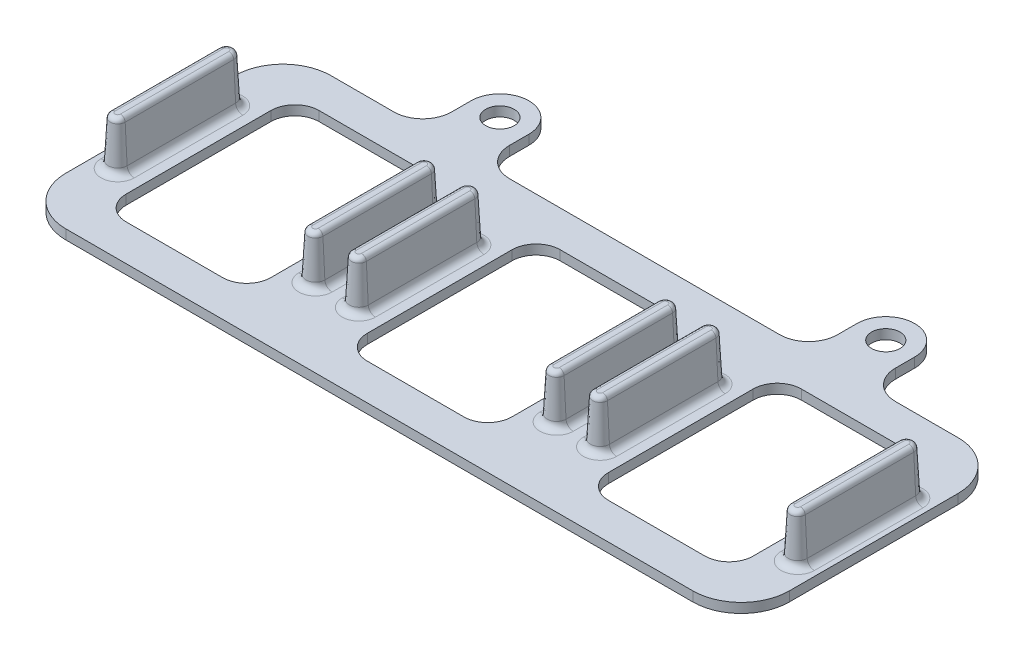
from build123d import *

# Parameters (mm, degrees)
SKETCH1_W                 = 150
SKETCH1_H                 = 55
BOSS_EXTRUDE1_DEPTH       = 2
SKETCH2_W                 = 12
SKETCH2_H                 = 16
SKETCH2_R                 = 2.95
BOSS_EXTRUDE2_DEPTH       = 2
FILLET1_R                 = 6
FILLET1_OF_MIRROR1_R      = 6
BOSS_EXTRUDE3_DEPTH       = 10
DRAFT1_ANGLE              = 3
FILLET2_R                 = 1.5
FILLET5_R                 = 1
DRAFT1_OF_MIRROR2_2_ANGLE = 3
FILLET2_OF_MIRROR2_R      = 1.5
FILLET5_OF_MIRROR2_R      = 1
SKETCH4_W                 = 30
SKETCH4_H                 = 40
CUT_EXTRUDE1_DEPTH        = 88.27685833
FILLET3_R                 = 5
LPATTERN1_START           = -15
LPATTERN1_OUTLINE_W       = 30
LPATTERN1_OUTLINE_H       = 2
LPATTERN1_DEPTH           = 30
LPATTERN1_START_2         = -11.25
LPATTERN1_2_DEPTH         = 22.5
LPATTERN1_START_3         = -1
LPATTERN1_11_DEPTH        = 3
FILLET4_R                 = 10


with BuildPart() as part:
    # Sketch1 → Boss-Extrude1 (new body)
    with BuildSketch(Plane(origin=(0, 0, 0), x_dir=(1, 0, 0), z_dir=(0, 1, 0))):
        Rectangle(SKETCH1_W, SKETCH1_H)
    extrude(amount=BOSS_EXTRUDE1_DEPTH)

    # Sketch2 → Boss-Extrude2 (add)
    with BuildSketch(Plane(origin=(0, 0, 0), x_dir=(1, 0, 0), z_dir=(0, 1, 0))):
        with Locations((40, 35.5)):
            Rectangle(SKETCH2_W, SKETCH2_H)
        with Locations(Location((40, 37.5, 0), (0, 0, 270))):
            Circle(SKETCH2_R, mode=Mode.SUBTRACT)
    boss_extrude2 = extrude(amount=BOSS_EXTRUDE2_DEPTH)

    # Fillet1
    fillet1_edges = [part.edges().sort_by_distance(p)[0] for p in [
        (34, 1, -27.5),
        (46, 1, -27.5),
    ]]
    fillet(fillet1_edges, radius=FILLET1_R)
    fillet1_2_edges = [part.edges().sort_by_distance(p)[0] for p in [
        (34, 1, -43.5),
        (46, 1, -43.5),
    ]]
    fillet(fillet1_2_edges, radius=FILLET1_R - 0.0001)  # a hair under: the kernel refuses the full size

    # Mirror1: Boss-Extrude2 across plane
    add(boss_extrude2.mirror(Plane(origin=(0, 0, 0), x_dir=(0, 0, 1), z_dir=(1, 0, 0))))

    # Fillet1 of Mirror1
    fillet1_of_mirror1_edges = [part.edges().sort_by_distance(p)[0] for p in [
        (-34, 1, -27.5),
        (-46, 1, -27.5),
    ]]
    fillet(fillet1_of_mirror1_edges, radius=FILLET1_OF_MIRROR1_R)
    fillet1_of_mirror1_2_edges = [part.edges().sort_by_distance(p)[0] for p in [
        (-34, 1, -43.5),
        (-46, 1, -43.5),
    ]]
    fillet(fillet1_of_mirror1_2_edges, radius=FILLET1_OF_MIRROR1_R - 0.0001)  # a hair under: the kernel refuses the full size

    # Sketch3 → Boss-Extrude3 (add)
    with BuildSketch(Plane(origin=(0, 2, 0), x_dir=(1, 0, 0), z_dir=(0, 1, 0))):
        with BuildLine():
            ThreePointArc((-19, 11.25), (-20.5, 12.75), (-22, 11.25))
            Line((-22, 11.25), (-19, 11.25))
        make_face()
        with BuildLine():
            Line((-19, 11.25), (-22, 11.25))
            ThreePointArc((-22, 11.25), (-20.5, 9.75), (-19, 11.25))
        make_face()
        with BuildLine():
            ThreePointArc((-19, 11.25), (-20.5, 9.75), (-22, 11.25))
            Line((-22, 11.25), (-22, -11.25))
            ThreePointArc((-22, -11.25), (-20.5, -9.75), (-19, -11.25))
            Line((-19, -11.25), (-19, 11.25))
        make_face()
        with BuildLine():
            ThreePointArc((-19, -11.25), (-20.5, -9.75), (-22, -11.25))
            Line((-22, -11.25), (-19, -11.25))
        make_face()
        with BuildLine():
            Line((-19, -11.25), (-22, -11.25))
            ThreePointArc((-22, -11.25), (-20.5, -12.75), (-19, -11.25))
        make_face()
    boss_extrude3 = extrude(amount=BOSS_EXTRUDE3_DEPTH)

    # Draft1
    draft1_faces = [part.faces().sort_by_distance(p)[0] for p in [
        (-20.5, 7, -12.75),
        (-22, 7, 0),
        (-20.5, 7, 12.75),
        (-19, 7, 0),
    ]]
    draft(draft1_faces, Plane.ZX.offset(12), DRAFT1_ANGLE)

    # Fillet2
    fillet2_edges = [part.edges().sort_by_distance(p)[0] for p in [
        (-20.5, 2, -13.274077793),
        (-22.524077793, 2, 0),
        (-20.5, 2, 13.274077793),
        (-18.475922207, 2, 0),
    ]]
    fillet(fillet2_edges, radius=FILLET2_R)

    # Fillet5
    fillet5_edges = [part.edges().sort_by_distance(p)[0] for p in [
        (-19, 12, 0),
        (-20.5, 12, -12.75),
        (-22, 12, 0),
        (-20.5, 12, 12.75),
    ]]
    fillet(fillet5_edges, radius=FILLET5_R)

    # Mirror2: Boss-Extrude3 across plane
    add(boss_extrude3.mirror(Plane(origin=(0, 0, 0), x_dir=(0, 0, 1), z_dir=(1, 0, 0))))

    # Draft1 of Mirror2 2
    draft1_of_mirror2_2_faces = [part.faces().sort_by_distance(p)[0] for p in [
        (20.5, 7, -12.75),
        (22, 7, 0),
        (20.5, 7, 12.75),
        (19, 7, 0),
    ]]
    draft(draft1_of_mirror2_2_faces, Plane.ZX.offset(12), DRAFT1_OF_MIRROR2_2_ANGLE)

    # Fillet2 of Mirror2
    fillet2_of_mirror2_edges = [part.edges().sort_by_distance(p)[0] for p in [
        (20.5, 2, -13.274077793),
        (22.524077793, 2, 0),
        (20.5, 2, 13.274077793),
        (18.475922207, 2, 0),
    ]]
    fillet(fillet2_of_mirror2_edges, radius=FILLET2_OF_MIRROR2_R)

    # Fillet5 of Mirror2
    fillet5_of_mirror2_edges = [part.edges().sort_by_distance(p)[0] for p in [
        (19, 12, 0),
        (20.5, 12, -12.75),
        (22, 12, 0),
        (20.5, 12, 12.75),
    ]]
    fillet(fillet5_of_mirror2_edges, radius=FILLET5_OF_MIRROR2_R)

    # Sketch4 → Cut-Extrude1 (cut, through all)
    with BuildSketch(Plane(origin=(0, 2, 0), x_dir=(1, 0, 0), z_dir=(0, 1, 0))):
        Rectangle(SKETCH4_W, SKETCH4_H)
    extrude(amount=-CUT_EXTRUDE1_DEPTH, mode=Mode.SUBTRACT)

    # Fillet3
    fillet3_edges = [part.edges().sort_by_distance(p)[0] for p in [
        (15, 1, -20),
        (15, 1, 20),
        (-15, 1, 20),
        (-15, 1, -20),
    ]]
    fillet(fillet3_edges, radius=FILLET3_R)

    # LPattern1: read off the stored shape, not the designer's step
    # LPattern1 outline → LPattern1 (cut)
    with BuildSketch(Plane.XY.offset(LPATTERN1_START)):
        with Locations((-50, 1)):
            Rectangle(LPATTERN1_OUTLINE_W, LPATTERN1_OUTLINE_H)
        with Locations((50, 1)):
            Rectangle(LPATTERN1_OUTLINE_W, LPATTERN1_OUTLINE_H)
    extrude(amount=LPATTERN1_DEPTH, mode=Mode.SUBTRACT)

    # LPattern1 2 outline → LPattern1 2 (add)
    with BuildSketch(Plane.XY.offset(LPATTERN1_START_2)):
        with BuildLine():
            ThreePointArc((-27.950335032, 11.052335956), (-28.260609991, 11.725374371), (-28.948964567, 12))
            Line((-28.948964567, 12), (-30.051035433, 12))
            ThreePointArc((-30.051035433, 12), (-30.739390009, 11.725374371), (-31.049664968, 11.052335956))
            Line((-31.049664968, 11.052335956), (-31.449580341, 3.421496066))
            ThreePointArc((-31.449580341, 3.421496066), (-31.914992779, 2.411938443), (-32.947524643, 2))
            Line((-32.947524643, 2), (-26.052475357, 2))
            ThreePointArc((-26.052475357, 2), (-27.085007221, 2.411938443), (-27.550419659, 3.421496066))
            Line((-27.550419659, 3.421496066), (-27.950335032, 11.052335956))
        make_face()
        with BuildLine():
            ThreePointArc((68.550419659, 3.421496066), (68.085007221, 2.411938443), (67.052475357, 2))
            Line((67.052475357, 2), (73.947524643, 2))
            ThreePointArc((73.947524643, 2), (72.914992779, 2.411938443), (72.449580341, 3.421496066))
            Line((72.449580341, 3.421496066), (72.049664968, 11.052335956))
            ThreePointArc((72.049664968, 11.052335956), (71.739390009, 11.725374371), (71.051035433, 12))
            Line((71.051035433, 12), (69.948964567, 12))
            ThreePointArc((69.948964567, 12), (69.260609991, 11.725374371), (68.950335032, 11.052335956))
            Line((68.950335032, 11.052335956), (68.550419659, 3.421496066))
        make_face()
        with BuildLine():
            Line((-73.947524643, 2), (-67.052475357, 2))
            ThreePointArc((-67.052475357, 2), (-68.085007221, 2.411938443), (-68.550419659, 3.421496066))
            Line((-68.550419659, 3.421496066), (-68.950335032, 11.052335956))
            ThreePointArc((-68.950335032, 11.052335956), (-69.260609991, 11.725374371), (-69.948964567, 12))
            Line((-69.948964567, 12), (-71.051035433, 12))
            ThreePointArc((-71.051035433, 12), (-71.739390009, 11.725374371), (-72.049664968, 11.052335956))
            Line((-72.049664968, 11.052335956), (-72.449580341, 3.421496066))
            ThreePointArc((-72.449580341, 3.421496066), (-72.914992779, 2.411938443), (-73.947524643, 2))
        make_face()
        with BuildLine():
            ThreePointArc((27.550419659, 3.421496066), (27.085007221, 2.411938443), (26.052475357, 2))
            Line((26.052475357, 2), (32.947524643, 2))
            ThreePointArc((32.947524643, 2), (31.914992779, 2.411938443), (31.449580341, 3.421496066))
            Line((31.449580341, 3.421496066), (31.049664968, 11.052335956))
            ThreePointArc((31.049664968, 11.052335956), (30.739390009, 11.725374371), (30.051035433, 12))
            Line((30.051035433, 12), (28.948964567, 12))
            ThreePointArc((28.948964567, 12), (28.260609991, 11.725374371), (27.950335032, 11.052335956))
            Line((27.950335032, 11.052335956), (27.550419659, 3.421496066))
        make_face()
    extrude(amount=LPATTERN1_2_DEPTH)

    # LPattern1 3 outline → LPattern1 3 (revolve)
    with BuildSketch(Plane(origin=(-29.5, 0, -11.25), x_dir=(1, 0, 0), z_dir=(0, 0, 1))):
        with BuildLine():
            Line((1.949580341, 3.421496066), (1.549664968, 11.052335956))
            ThreePointArc((1.549664968, 11.052335956), (1.239390009, 11.725374371), (0.551035433, 12))
            Line((0.551035433, 12), (0, 12))
            Line((0, 12), (0, 2))
            Line((0, 2), (3.447524643, 2))
            ThreePointArc((3.447524643, 2), (2.414992779, 2.411938443), (1.949580341, 3.421496066))
        make_face()
    revolve(axis=Axis((-29.5, 0, -11.25), (0, 1, 0)))

    # LPattern1 4 outline → LPattern1 4 (revolve)
    with BuildSketch(Plane(origin=(-29.5, 0, 11.25), x_dir=(1, 0, 0), z_dir=(0, 0, 1))):
        with BuildLine():
            Line((1.949580341, 3.421496066), (1.549664968, 11.052335956))
            ThreePointArc((1.549664968, 11.052335956), (1.239390009, 11.725374371), (0.551035433, 12))
            Line((0.551035433, 12), (0, 12))
            Line((0, 12), (0, 2))
            Line((0, 2), (3.447524643, 2))
            ThreePointArc((3.447524643, 2), (2.414992779, 2.411938443), (1.949580341, 3.421496066))
        make_face()
    revolve(axis=Axis((-29.5, 0, 11.25), (0, 1, 0)))

    # LPattern1 5 outline → LPattern1 5 (revolve)
    with BuildSketch(Plane(origin=(70.5, 0, -11.25), x_dir=(1, 0, 0), z_dir=(0, 0, 1))):
        with BuildLine():
            Line((1.949580341, 3.421496066), (1.549664968, 11.052335956))
            ThreePointArc((1.549664968, 11.052335956), (1.239390009, 11.725374371), (0.551035433, 12))
            Line((0.551035433, 12), (0, 12))
            Line((0, 12), (0, 2))
            Line((0, 2), (3.447524643, 2))
            ThreePointArc((3.447524643, 2), (2.414992779, 2.411938443), (1.949580341, 3.421496066))
        make_face()
    revolve(axis=Axis((70.5, 0, -11.25), (0, 1, 0)))

    # LPattern1 6 outline → LPattern1 6 (revolve)
    with BuildSketch(Plane(origin=(70.5, 0, 11.25), x_dir=(1, 0, 0), z_dir=(0, 0, 1))):
        with BuildLine():
            Line((1.949580341, 3.421496066), (1.549664968, 11.052335956))
            ThreePointArc((1.549664968, 11.052335956), (1.239390009, 11.725374371), (0.551035433, 12))
            Line((0.551035433, 12), (0, 12))
            Line((0, 12), (0, 2))
            Line((0, 2), (3.447524643, 2))
            ThreePointArc((3.447524643, 2), (2.414992779, 2.411938443), (1.949580341, 3.421496066))
        make_face()
    revolve(axis=Axis((70.5, 0, 11.25), (0, 1, 0)))

    # LPattern1 7 outline → LPattern1 7 (revolve)
    with BuildSketch(Plane(origin=(29.5, 0, -11.25), x_dir=(1, 0, 0), z_dir=(0, 0, 1))):
        with BuildLine():
            Line((1.949580341, 3.421496066), (1.549664968, 11.052335956))
            ThreePointArc((1.549664968, 11.052335956), (1.239390009, 11.725374371), (0.551035433, 12))
            Line((0.551035433, 12), (0, 12))
            Line((0, 12), (0, 2))
            Line((0, 2), (3.447524643, 2))
            ThreePointArc((3.447524643, 2), (2.414992779, 2.411938443), (1.949580341, 3.421496066))
        make_face()
    revolve(axis=Axis((29.5, 0, -11.25), (0, 1, 0)))

    # LPattern1 8 outline → LPattern1 8 (revolve)
    with BuildSketch(Plane(origin=(29.5, 0, 11.25), x_dir=(1, 0, 0), z_dir=(0, 0, 1))):
        with BuildLine():
            Line((1.949580341, 3.421496066), (1.549664968, 11.052335956))
            ThreePointArc((1.549664968, 11.052335956), (1.239390009, 11.725374371), (0.551035433, 12))
            Line((0.551035433, 12), (0, 12))
            Line((0, 12), (0, 2))
            Line((0, 2), (3.447524643, 2))
            ThreePointArc((3.447524643, 2), (2.414992779, 2.411938443), (1.949580341, 3.421496066))
        make_face()
    revolve(axis=Axis((29.5, 0, 11.25), (0, 1, 0)))

    # LPattern1 9 outline → LPattern1 9 (revolve)
    with BuildSketch(Plane(origin=(-70.5, 0, -11.25), x_dir=(1, 0, 0), z_dir=(0, 0, 1))):
        with BuildLine():
            Line((1.949580341, 3.421496066), (1.549664968, 11.052335956))
            ThreePointArc((1.549664968, 11.052335956), (1.239390009, 11.725374371), (0.551035433, 12))
            Line((0.551035433, 12), (0, 12))
            Line((0, 12), (0, 2))
            Line((0, 2), (3.447524643, 2))
            ThreePointArc((3.447524643, 2), (2.414992779, 2.411938443), (1.949580341, 3.421496066))
        make_face()
    revolve(axis=Axis((-70.5, 0, -11.25), (0, 1, 0)))

    # LPattern1 10 outline → LPattern1 10 (revolve)
    with BuildSketch(Plane(origin=(-70.5, 0, 11.25), x_dir=(1, 0, 0), z_dir=(0, 0, 1))):
        with BuildLine():
            Line((1.949580341, 3.421496066), (1.549664968, 11.052335956))
            ThreePointArc((1.549664968, 11.052335956), (1.239390009, 11.725374371), (0.551035433, 12))
            Line((0.551035433, 12), (0, 12))
            Line((0, 12), (0, 2))
            Line((0, 2), (3.447524643, 2))
            ThreePointArc((3.447524643, 2), (2.414992779, 2.411938443), (1.949580341, 3.421496066))
        make_face()
    revolve(axis=Axis((-70.5, 0, 11.25), (0, 1, 0)))

    # LPattern1 11 outline → LPattern1 11 (cut)
    with BuildSketch(Plane(origin=(0, 0, 0), x_dir=(1, 0, 0), z_dir=(0, 1, 0)).offset(LPATTERN1_START_3)):
        with BuildLine():
            ThreePointArc((35, -15), (36.464466094, -18.535533906), (40, -20))
            Line((40, -20), (60, -20))
            ThreePointArc((60, -20), (63.535533906, -18.535533906), (65, -15))
            Line((65, -15), (35, -15))
        make_face()
        with BuildLine():
            ThreePointArc((-65, -15), (-63.535533906, -18.535533906), (-60, -20))
            Line((-60, -20), (-40, -20))
            ThreePointArc((-40, -20), (-36.464466094, -18.535533906), (-35, -15))
            Line((-35, -15), (-65, -15))
        make_face()
        with BuildLine():
            ThreePointArc((65, 15), (63.535533906, 18.535533906), (60, 20))
            Line((60, 20), (40, 20))
            ThreePointArc((40, 20), (36.464466094, 18.535533906), (35, 15))
            Line((35, 15), (65, 15))
        make_face()
        with BuildLine():
            ThreePointArc((-35, 15), (-36.464466094, 18.535533906), (-40, 20))
            Line((-40, 20), (-60, 20))
            ThreePointArc((-60, 20), (-63.535533906, 18.535533906), (-65, 15))
            Line((-65, 15), (-35, 15))
        make_face()
    extrude(amount=LPATTERN1_11_DEPTH, mode=Mode.SUBTRACT)

    # Fillet4
    fillet4_edges = [part.edges().sort_by_distance(p)[0] for p in [
        (-75, 1, -27.5),
        (75, 1, -27.5),
        (75, 1, 27.5),
        (-75, 1, 27.5),
    ]]
    fillet(fillet4_edges, radius=FILLET4_R)


solid = part.part
